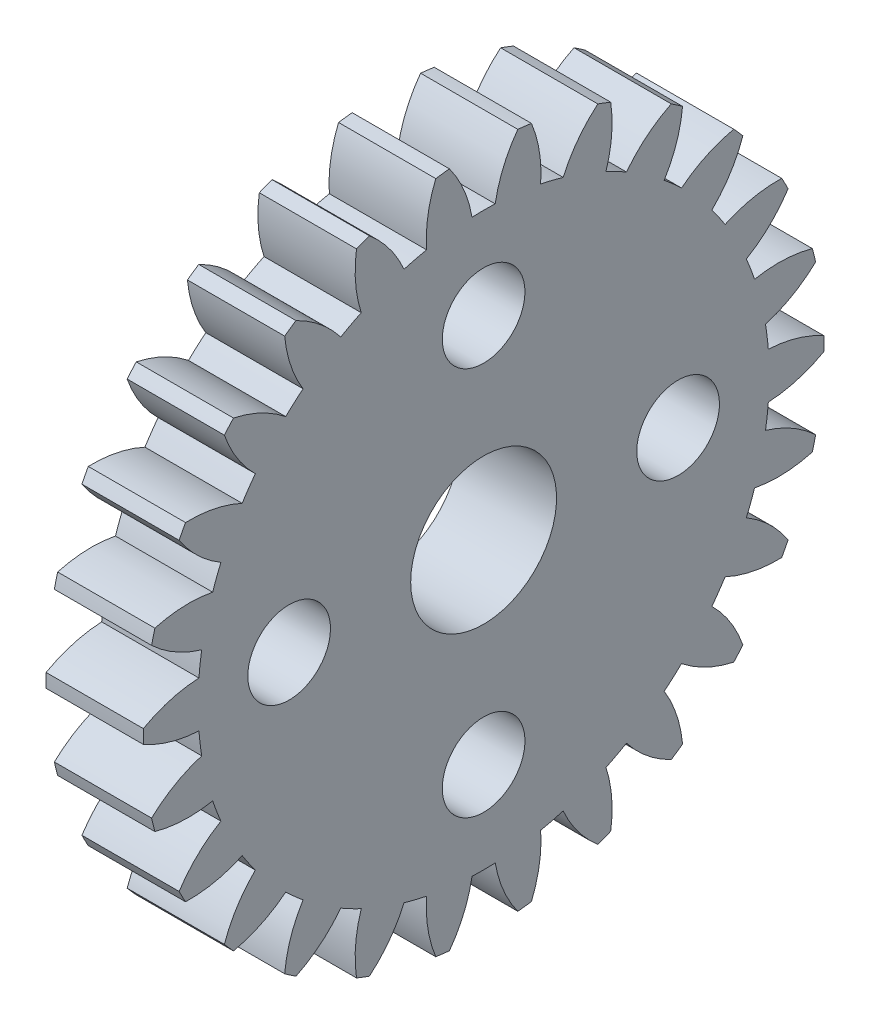
from build123d import *

# Parameters (mm, degrees)
BASPROSKE_W        = 4
BASPROSKE_H        = 14
TOOTHCUT_DEPTH     = 21.199009877
TEETHCUTS_COUNT    = 26
TEETHCUTS_ANGLE    = 346.153846154
BORSKE_R           = 3
BORE_DEPTH         = 50.0000508
HOLE_WIZARD_M3_1_D = 3.4
CIRPATTERN1_COUNT  = 4


with BuildPart() as part:
    # BasProSke → Base-Revolve (revolve)
    with BuildSketch(Plane(origin=(0, 0, 0), x_dir=(1, 0, 0), z_dir=(0, 1, 0))):
        with Locations((2, 7)):
            Rectangle(BASPROSKE_W, BASPROSKE_H)
    revolve(axis=Axis((-10, 0, 0), (1, 0, 0)))

    # TooCutSke → ToothCut (cut, through all)
    with BuildSketch(Plane(origin=(0, 0, 0), x_dir=(0, 0, -1), z_dir=(1, 0, 0))):
        with BuildLine():
            ThreePointArc((0.476965065, 11.739314517), (0, 11.749), (-0.476965065, 11.739314517))
            ThreePointArc((-0.476965065, 11.739314517), (-0.82065865, 12.901686978), (-1.424117301, 13.952911348))
            ThreePointArc((-1.424117301, 13.952911348), (0, 14.0254), (1.424117301, 13.952911348))
            ThreePointArc((1.424117301, 13.952911348), (0.82065865, 12.901686978), (0.476965065, 11.739314517))
        make_face()
    toothcut = extrude(amount=TOOTHCUT_DEPTH, mode=Mode.SUBTRACT)

    # TeethCuts: ToothCut ×26 about axis
    teethcuts_axis = Axis((-10, 0, 0), (1, 0, 0))
    for i in range(1, TEETHCUTS_COUNT):
        add(toothcut.rotate(teethcuts_axis, i * TEETHCUTS_ANGLE / (TEETHCUTS_COUNT - 1)), mode=Mode.SUBTRACT)

    # BorSke → Bore (cut, symmetric)
    with BuildSketch(Plane(origin=(0, 0, 0), x_dir=(0, 0, -1), z_dir=(1, 0, 0))):
        Circle(BORSKE_R)
    extrude(amount=BORE_DEPTH, both=True, mode=Mode.SUBTRACT)

    # M3 餘隙孔1 (through all)
    with Locations(Plane(origin=(4, 0, 0), x_dir=(0, 0, -1), z_dir=(1, 0, 0))):
        with Locations((0, 8)):
            hole_wizard_m3_1 = Hole(HOLE_WIZARD_M3_1_D / 2)

    # CirPattern1: M3 餘隙孔1 ×4 about axis
    cirpattern1_axis = Axis((50.0000508, 0, 0), (-1, 0, 0))
    for i in range(1, CIRPATTERN1_COUNT):
        add(hole_wizard_m3_1.rotate(cirpattern1_axis, i * 360 / CIRPATTERN1_COUNT), mode=Mode.SUBTRACT)


solid = part.part
